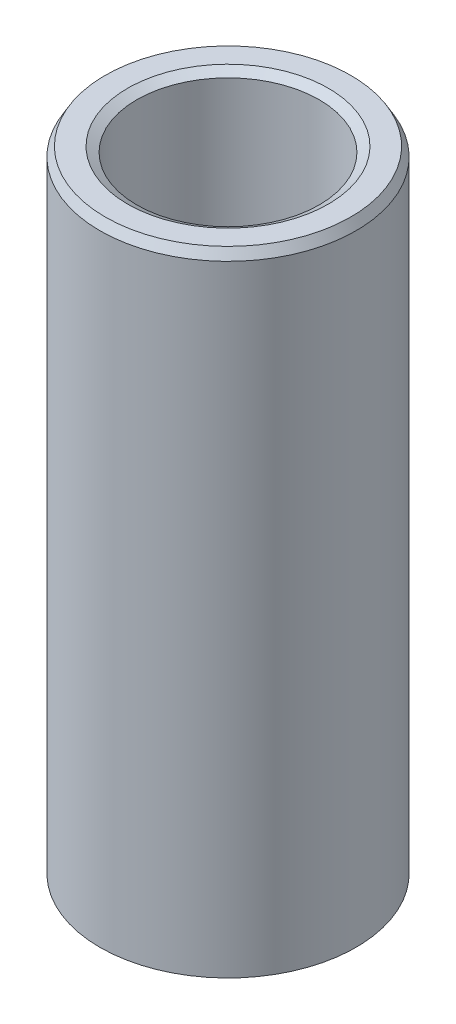
from build123d import *
from OCP.BRepFilletAPI import BRepFilletAPI_MakeChamfer

# Parameters (mm, degrees)
SKETCH1_R           = 15
BOSS_EXTRUDE1_DEPTH = 74.38582973
SKETCH2_R           = 10.680410684
CUT_EXTRUDE1_DEPTH  = 78.351481335
CHAMFER1_SIZE       = 1.078345111
CHAMFER1_SIZE2      = 0.62258284


with BuildPart() as part:
    # Sketch1 → Boss-Extrude1 (new body)
    with BuildSketch(Plane(origin=(0, 0, 0), x_dir=(1, 0, 0), z_dir=(0, 1, 0))):
        Circle(SKETCH1_R)
    extrude(amount=BOSS_EXTRUDE1_DEPTH)

    # Sketch2 → Cut-Extrude1 (cut, through all)
    with BuildSketch(Plane(origin=(0, 0, 0), x_dir=(1, 0, 0), z_dir=(0, 1, 0))):
        Circle(SKETCH2_R)
    extrude(amount=CUT_EXTRUDE1_DEPTH, mode=Mode.SUBTRACT)

    # Chamfer1: one chamfer whose edges measure the first distance from different faces: ONE call of the kernel's chamfer builder (chamfer() names one face for all edges)
    chamfer1_edges_1 = [part.edges().sort_by_distance(p)[0] for p in [
        (-10.680410684, 74.38582973, 0),
    ]]
    chamfer1_side_1 = [part.faces().sort_by_distance(p)[0] for p in [
        (-14.575735931, 74.38582973, 0),
    ]]
    chamfer1_edges_2 = [part.edges().sort_by_distance(p)[0] for p in [
        (-10.680410684, 0, 0),
    ]]
    chamfer1_side_2 = [part.faces().sort_by_distance(p)[0] for p in [
        (-10.680410684, 37.192914865, 0),
    ]]
    chamfer1_edges_3 = [part.edges().sort_by_distance(p)[0] for p in [
        (-15, 0, 0),
    ]]
    chamfer1_side_3 = [part.faces().sort_by_distance(p)[0] for p in [
        (-14.575735931, 0, 0),
    ]]
    chamfer1_edges_4 = [part.edges().sort_by_distance(p)[0] for p in [
        (-15, 74.38582973, 0),
    ]]
    chamfer1_side_4 = [part.faces().sort_by_distance(p)[0] for p in [
        (-15, 37.192914865, 0),
    ]]
    chamfer1 = BRepFilletAPI_MakeChamfer(part.part.solid().wrapped)
    for e in chamfer1_edges_1:
        chamfer1.Add(CHAMFER1_SIZE, CHAMFER1_SIZE2, e.wrapped, chamfer1_side_1[0].wrapped)  # the first distance lies on this face
    for e in chamfer1_edges_2:
        chamfer1.Add(CHAMFER1_SIZE, CHAMFER1_SIZE2, e.wrapped, chamfer1_side_2[0].wrapped)  # the first distance lies on this face
    for e in chamfer1_edges_3:
        chamfer1.Add(CHAMFER1_SIZE, CHAMFER1_SIZE2, e.wrapped, chamfer1_side_3[0].wrapped)  # the first distance lies on this face
    for e in chamfer1_edges_4:
        chamfer1.Add(CHAMFER1_SIZE, CHAMFER1_SIZE2, e.wrapped, chamfer1_side_4[0].wrapped)  # the first distance lies on this face
    add(Compound.cast(chamfer1.Shape()), mode=Mode.REPLACE)


solid = part.part
